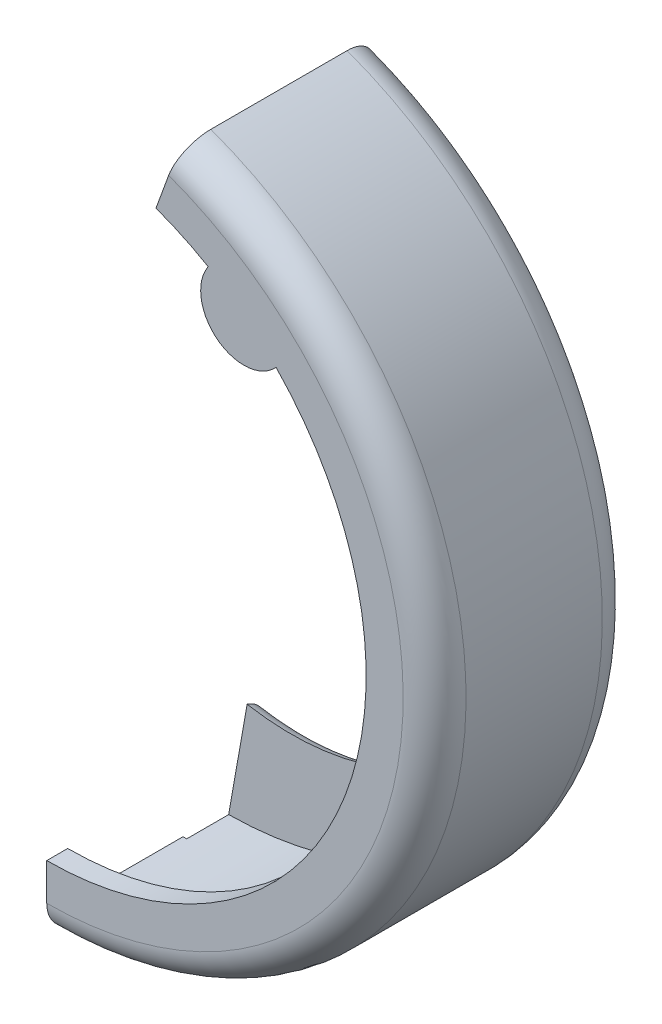
from build123d import *

# Parameters (mm, degrees)
SKETCH1_W                = 15
SKETCH1_H                = 35
REVOLVE1_ANGLE           = 160
SHELL1_T                 = 2
CUT_EXTRUDE4_DEPTH       = 73.816816531
CUT_EXTRUDE4_DEPTH_BACK  = 6
CUT_EXTRUDE5_DEPTH       = 73.816816531
CUT_EXTRUDE5_DEPTH_BACK  = 6
BOSS_EXTRUDE1_START      = -2
SKETCH9_R                = 4.124065783
BOSS_EXTRUDE1_DEPTH      = 2
FILLET4_R                = 3
FILLET5_R                = 3
CUT_EXTRUDE15_DEPTH      = 73.816816664
CUT_EXTRUDE15_DEPTH_BACK = 2
FILLET9_R                = 3


with BuildPart() as part:
    # Sketch1 → Revolve1 (revolve)
    with BuildSketch(Plane(origin=(0, 0, 0), x_dir=(0, 0, -1), z_dir=(1, 0, 0))):
        with Locations((-17.5, 7.5)):
            Rectangle(SKETCH1_W, SKETCH1_H)
    revolve(axis=Axis((0, 25, 25), (0, 0, 1)), revolution_arc=REVOLVE1_ANGLE)

    # Shell1
    shell1_openings = [part.faces().sort_by_distance(p)[0] for p in [
        (0, 7.5, 17.5),
        (5.985352508, 41.444620864, 17.5),
    ]]
    offset(amount=SHELL1_T, openings=shell1_openings, kind=Kind.INTERSECTION)

    # Sketch5 → Cut-Extrude4 (cut, two sides: drawn at the far end of the back side and taken through both)
    with BuildSketch(Plane.XY.offset(27).offset(-CUT_EXTRUDE4_DEPTH_BACK)):
        with BuildLine():
            Line((-139.932865383, 108.358884102), (10.421993206, 53.634190998))
            ThreePointArc((10.421993206, 53.634190998), (30.008933424, 19.708615375), (0, -5.471869593))
            Line((0, -5.471869593), (-160.004298494, -5.471869593))
            Line((-160.004298494, -5.471869593), (-475.151245838, 50.097040112))
            Line((-475.151245838, 50.097040112), (-455.079812728, 163.927793806))
            Line((-455.079812728, 163.927793806), (-139.932865383, 108.358884102))
        make_face()
    extrude(amount=CUT_EXTRUDE4_DEPTH + CUT_EXTRUDE4_DEPTH_BACK, mode=Mode.SUBTRACT)

    # Sketch7 → Cut-Extrude5 (cut, two sides: drawn at the far end of the back side and taken through both)
    with BuildSketch(Plane(origin=(0, 0, 8), x_dir=(-1, 0, 0), z_dir=(0, 0, -1)).offset(-CUT_EXTRUDE5_DEPTH_BACK)):
        Polygon((-42.433629983, 228.653074263), (-12.654745303, 59.768626969), (0, -12), (29.77888468, -180.884447294), (367.547779267, -121.326677934), (295.335264604, 288.210843622), align=None)
    extrude(amount=CUT_EXTRUDE5_DEPTH + CUT_EXTRUDE5_DEPTH_BACK, mode=Mode.SUBTRACT)

    # Sketch9 → Boss-Extrude1 (add)
    with BuildSketch(Plane.XY.offset(27).offset(BOSS_EXTRUDE1_START)):
        with Locations((18.809520277, 48.973668543)):
            Circle(SKETCH9_R)
    extrude(amount=BOSS_EXTRUDE1_DEPTH)

    # Fillet4
    fillet4_edges = [part.edges().sort_by_distance(p)[0] for p in [
        (36.437886861, 18.575017426, 27),
    ]]
    fillet(fillet4_edges, radius=FILLET4_R)

    # Fillet5
    fillet5_edges = [part.edges().sort_by_distance(p)[0] for p in [
        (36.437886861, 18.575017426, 8),
    ]]
    fillet(fillet5_edges, radius=FILLET5_R)

    # Sketch13 → Cut-Extrude15 (cut, two sides: drawn at the far end of the back side and taken through both)
    with BuildSketch(Plane(origin=(0, 0, 8), x_dir=(-1, 0, 0), z_dir=(0, 0, -1)).offset(-CUT_EXTRUDE15_DEPTH_BACK)):
        with BuildLine():
            Line((144.037339106, 25.770763563), (-2.115923769, 0))
            ThreePointArc((-2.115923769, 0), (-30.211686136, 19.672864602), (-10.538821535, 47.768626969))
            Line((-10.538821535, 47.768626969), (135.61444134, 73.539390533))
            Line((135.61444134, 73.539390533), (427.92096709, 125.080917659))
            Line((427.92096709, 125.080917659), (436.343864856, 77.31229069))
            Line((436.343864856, 77.31229069), (144.037339106, 25.770763563))
        make_face()
    extrude(amount=CUT_EXTRUDE15_DEPTH + CUT_EXTRUDE15_DEPTH_BACK, mode=Mode.SUBTRACT)

    # Fillet9
    # the kernel refuses this fillet: 3 mm, written as the material it takes off along each edge
    with BuildSketch(Plane(origin=(6.327372652, 23.884313485, 8), x_dir=(-0.44981568414947964, -0.8931214084843873, 0), z_dir=(-0.8931214084843873, 0.44981568414947964, 0))) as fillet9_piece_1:
        with BuildLine():
            CenterArc((27.081194644, 3), FILLET9_R, 199.471220634, 70.528779366)
            Line((24.252767519, 2), (24.196198976, 1.98))
            ThreePointArc((24.196198976, 1.98), (24.192767519, 1), (24.192767519, 0))
            Line((24.192767519, 0), (24.252767519, -0.06))
            Line((24.252767519, -0.06), (27.081194644, -0.06))
            Line((27.081194644, -0.06), (27.081194644, 0))
        make_face()
    revolve(axis=Axis((6.327372652, 23.884313485, 8), (0, 0, 1)), revolution_arc=213.463718105, mode=Mode.SUBTRACT)


solid = part.part
